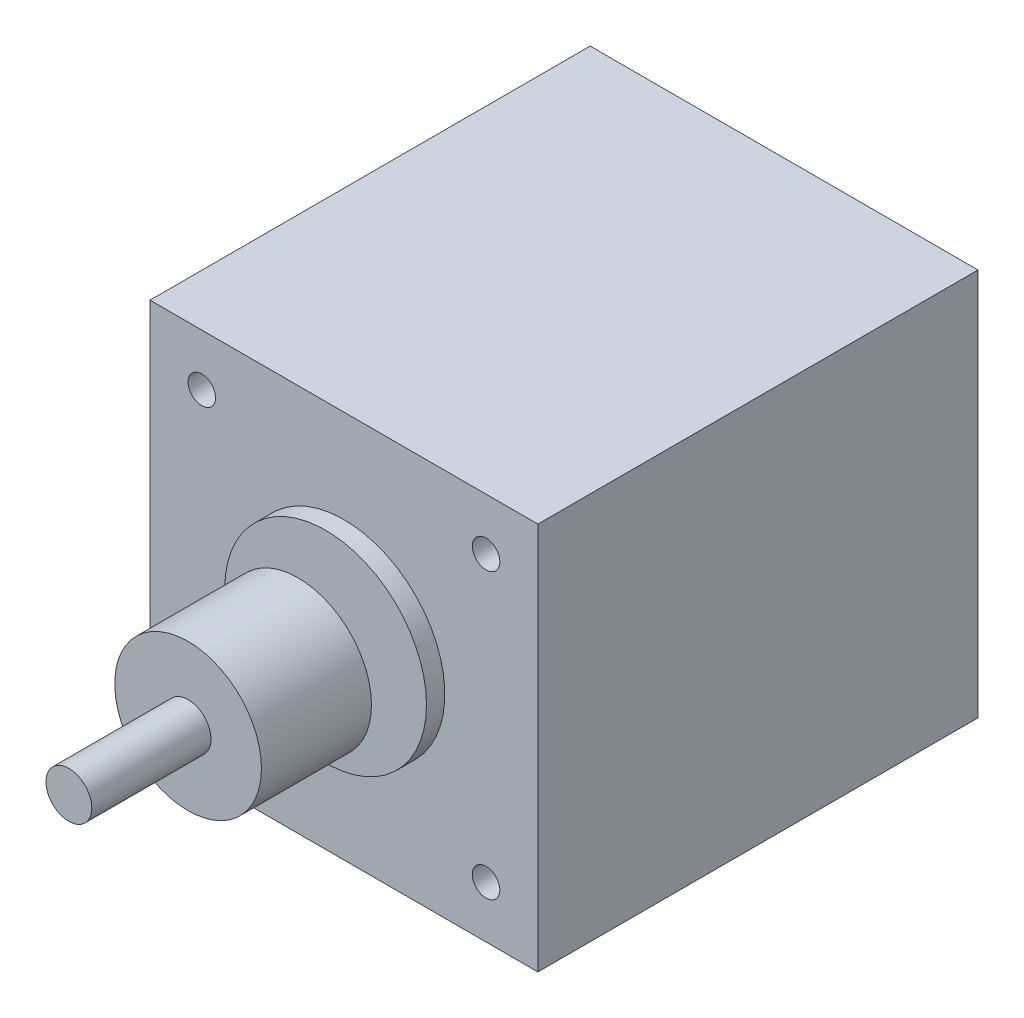
from build123d import *

# Parameters (mm, degrees)
SKETCH_1_W          = 42.3
SKETCH_1_H          = 42.3
EXTRUDE_1339_DEPTH  = 48
SKETCH_2_R          = 2.5
EXTRUDE_1394_DEPTH  = 78
SKETCH_3_R          = 11
EXTRUDE_1441_DEPTH  = 50
EXTRUDE_START       = 53
SKETCH_4_R          = 8
EXTRUDE_1487_DEPTH  = 12
CUT_EXTRUDE_START   = 48
SKETCH_5_R          = 1.5
CUT_EXTRUDE_3_DEPTH = 4.5


with BuildPart() as part:
    # Эскиз1 → Extrude 1339 (new body)
    with BuildSketch(Plane.XY):
        Rectangle(SKETCH_1_W, SKETCH_1_H)
    extrude(amount=EXTRUDE_1339_DEPTH)

    # Эскиз2 → Extrude 1394 (add)
    with BuildSketch(Plane.XY):
        Circle(SKETCH_2_R)
    extrude(amount=EXTRUDE_1394_DEPTH)

    # Эскиз3 → Extrude 1441 (add)
    with BuildSketch(Plane.XY):
        Circle(SKETCH_3_R)
    extrude(amount=EXTRUDE_1441_DEPTH)

    # Эскиз4 → Extrude 1487 (add)
    with BuildSketch(Plane.XY.offset(EXTRUDE_START)):
        Circle(SKETCH_4_R)
    extrude(amount=EXTRUDE_1487_DEPTH)

    # Эскиз5 → Крепеж_М3_ПРЕДВ (cut)
    with BuildSketch(Plane.XY.offset(CUT_EXTRUDE_START)):
        with Locations((-15.5, -15.5)):
            Circle(SKETCH_5_R)
        with Locations((-15.5, 15.5)):
            Circle(SKETCH_5_R)
        with Locations((15.5, -15.5)):
            Circle(SKETCH_5_R)
        with Locations((15.5, 15.5)):
            Circle(SKETCH_5_R)
    extrude(amount=-CUT_EXTRUDE_3_DEPTH, mode=Mode.SUBTRACT)


solid = part.part
